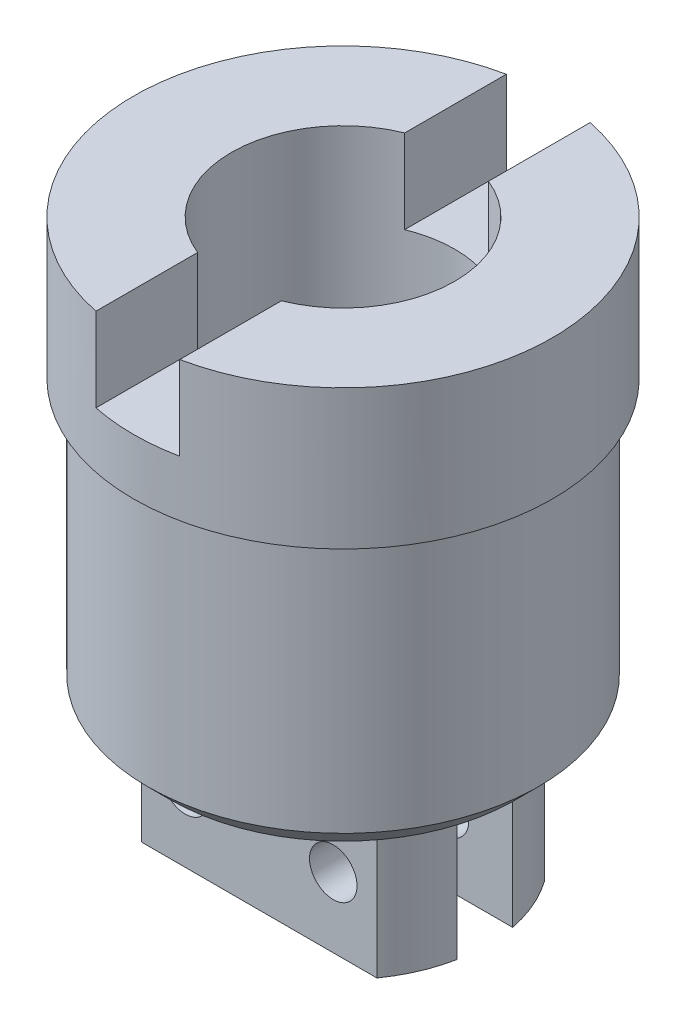
from build123d import *

# Parameters (mm, degrees)
CROQUIS1_R                               = 7.5
CROQUIS1_R_2                             = 4
SALIENTE_EXTRUIR1_DEPTH                  = 15
CROQUIS2_W                               = 3
CROQUIS2_H                               = 16.302446726
CORTAR_EXTRUIR1_DEPTH                    = 3
SALIENTE_EXTRUIR2_START                  = 5
SALIENTE_EXTRUIR2_DEPTH                  = 5
TALADRO_DE_MARGEN_PARA_M1_61_D           = 1.7
TALADRO_DE_MARGEN_PARA_M1_61_CSINK_D     = 1.75
TALADRO_DE_MARGEN_PARA_M1_61_CSINK_ANGLE = 82
REDONDEO1_R                              = 2
SALIENTE_EXTRUIR3_DEPTH                  = 5


# Read off the part's stored shape, not the designer's step: M14x1.5 Roscas Standard Taladro1
with BuildPart() as part:
    # Croquis1 → Saliente-Extruir1 (new body)
    with BuildSketch(Plane(origin=(0, 0, 0), x_dir=(1, 0, 0), z_dir=(0, 1, 0))):
        with Locations(Location((0, 0, 0), (0, 0, 270))):
            Circle(CROQUIS1_R)
        with Locations(Location((0, 0, 0), (0, 0, 270))):
            Circle(CROQUIS1_R_2, mode=Mode.SUBTRACT)
    extrude(amount=SALIENTE_EXTRUIR1_DEPTH)

    # Croquis2 → Cortar-Extruir1 (cut)
    with BuildSketch(Plane(origin=(0, 15, 0), x_dir=(1, 0, 0), z_dir=(0, 1, 0))):
        Rectangle(CROQUIS2_W, CROQUIS2_H)
    extrude(amount=-CORTAR_EXTRUIR1_DEPTH, mode=Mode.SUBTRACT)

    # M14x1.5 Roscas Standard Taladro1 outline → M14x1.5 Roscas Standard Taladro1 (revolve, cut)
    with BuildSketch(Plane.XY):
        Polygon((6.172, 0), (7.5, 0), (7.5, 10), (7, 10), (7, 0.828), align=None)
    revolve(axis=Axis((0, 0, 0), (0, 1, 0)), mode=Mode.SUBTRACT)

    # Croquis4 → Saliente-Extruir2 (add)
    with BuildSketch(Plane.XZ.offset(SALIENTE_EXTRUIR2_START)):
        with BuildLine():
            ThreePointArc((2.645751311, -3), (3.409321836, -2.092014488), (3.872983346, -1))
            Line((3.872983346, -1), (-3.872983346, -1))
            ThreePointArc((-3.872983346, -1), (-3.409321836, -2.092014488), (-2.645751311, -3))
            Line((-2.645751311, -3), (2.645751311, -3))
        make_face()
        with BuildLine():
            Line((-3.872983346, 1), (3.872983346, 1))
            ThreePointArc((3.872983346, 1), (3.409321836, 2.092014488), (2.645751311, 3))
            Line((2.645751311, 3), (-2.645751311, 3))
            ThreePointArc((-2.645751311, 3), (-3.409321836, 2.092014488), (-3.872983346, 1))
        make_face()
        with BuildLine():
            Line((3.872983346, 1), (5.074404793, 1))
            ThreePointArc((5.074404793, 1), (4.750167411, 2.045847884), (4.213025516, 3))
            Line((4.213025516, 3), (2.645751311, 3))
            ThreePointArc((2.645751311, 3), (3.409321836, 2.092014488), (3.872983346, 1))
        make_face()
        with BuildLine():
            Line((-5.074404793, 1), (-3.872983346, 1))
            ThreePointArc((-3.872983346, 1), (-3.409321836, 2.092014488), (-2.645751311, 3))
            Line((-2.645751311, 3), (-4.213025516, 3))
            ThreePointArc((-4.213025516, 3), (-4.750167411, 2.045847884), (-5.074404793, 1))
        make_face()
        with BuildLine():
            ThreePointArc((4.213025516, -3), (4.750167411, -2.045847884), (5.074404793, -1))
            Line((5.074404793, -1), (3.872983346, -1))
            ThreePointArc((3.872983346, -1), (3.409321836, -2.092014488), (2.645751311, -3))
            Line((2.645751311, -3), (4.213025516, -3))
        make_face()
        with BuildLine():
            ThreePointArc((-2.645751311, -3), (-3.409321836, -2.092014488), (-3.872983346, -1))
            Line((-3.872983346, -1), (-5.074404793, -1))
            ThreePointArc((-5.074404793, -1), (-4.750167411, -2.045847884), (-4.213025516, -3))
            Line((-4.213025516, -3), (-2.645751311, -3))
        make_face()
    extrude(amount=-SALIENTE_EXTRUIR2_DEPTH)

    # Taladro de margen para M1.61 (through all)
    with Locations(Plane(origin=(0, 0, -3), x_dir=(1, 0, 0), z_dir=(0, 0, -1))):
        with Locations((2.65, 2.5), (-2.65, 2.5)):
            CounterSinkHole(TALADRO_DE_MARGEN_PARA_M1_61_D / 2, TALADRO_DE_MARGEN_PARA_M1_61_CSINK_D / 2, counter_sink_angle=TALADRO_DE_MARGEN_PARA_M1_61_CSINK_ANGLE)

    # Redondeo1
    # the kernel refuses this fillet: 2 mm, written as the material it adds along each edge
    with BuildSketch(Plane(origin=(0, 0, 0), x_dir=(0.503234651569935, 0, -0.8641498049871251), z_dir=(0.8641498049871251, 0, 0.503234651569935))) as redondeo1_piece_1_section:
        with BuildLine():
            CenterArc((4 - REDONDEO1_R, REDONDEO1_R), REDONDEO1_R, 270, 90)
            Line((4 - REDONDEO1_R, 0), (4, 0))
            Line((4, 0), (4, REDONDEO1_R))
        make_face()
    redondeo1_piece_1 = revolve(axis=Axis((0, 0, 0), (0, 1, 0)), revolution_arc=177.360579055, mode=Mode.PRIVATE)
    redondeo1_piece_1 = split(redondeo1_piece_1, bisect_by=Plane(origin=(0.549602468, 0.055077536, -1), z_dir=(0, 0, -1)), keep=Keep.TOP, mode=Mode.PRIVATE)
    redondeo1_piece_1 = split(redondeo1_piece_1, bisect_by=Plane(origin=(0.549602468, 0.055077536, -3), z_dir=(0, 0, 1)), keep=Keep.TOP, mode=Mode.PRIVATE)
    add(redondeo1_piece_1)
    with BuildSketch(Plane(origin=(0, 0, 0), x_dir=(0.503234651569935, 0, -0.8641498049871251), z_dir=(0.8641498049871251, 0, 0.503234651569935))) as redondeo1_piece_2_section:
        with BuildLine():
            CenterArc((4 - REDONDEO1_R, REDONDEO1_R), REDONDEO1_R, 270, 90)
            Line((4 - REDONDEO1_R, 0), (4, 0))
            Line((4, 0), (4, REDONDEO1_R))
        make_face()
    redondeo1_piece_2 = revolve(axis=Axis((0, 0, 0), (0, 1, 0)), revolution_arc=177.360579055, mode=Mode.PRIVATE)
    redondeo1_piece_2 = split(redondeo1_piece_2, bisect_by=Plane(origin=(-2.883008057, 0.461894683, 3), z_dir=(0, 0, -1)), keep=Keep.TOP, mode=Mode.PRIVATE)
    redondeo1_piece_2 = split(redondeo1_piece_2, bisect_by=Plane(origin=(-2.883008057, 0.461894683, 1), z_dir=(0, 0, 1)), keep=Keep.TOP, mode=Mode.PRIVATE)
    add(redondeo1_piece_2)
    with BuildSketch(Plane(origin=(0, 0, 0), x_dir=(0.5424951341174628, 0, 0.8400589440383789), z_dir=(-0.8400589440383789, 0, 0.5424951341174628))) as redondeo1_piece_3_section:
        with BuildLine():
            CenterArc((4 - REDONDEO1_R, REDONDEO1_R), REDONDEO1_R, 270, 90)
            Line((4 - REDONDEO1_R, 0), (4, 0))
            Line((4, 0), (4, REDONDEO1_R))
        make_face()
    redondeo1_piece_3 = revolve(axis=Axis((0, 0, 0), (0, 1, 0)), revolution_arc=177.360579055, mode=Mode.PRIVATE)
    redondeo1_piece_3 = split(redondeo1_piece_3, bisect_by=Plane(origin=(2.883008085, 0.461894764, 3), z_dir=(0, 0, -1)), keep=Keep.TOP, mode=Mode.PRIVATE)
    redondeo1_piece_3 = split(redondeo1_piece_3, bisect_by=Plane(origin=(2.883008085, 0.461894764, 1), z_dir=(0, 0, 1)), keep=Keep.TOP, mode=Mode.PRIVATE)
    add(redondeo1_piece_3)
    with BuildSketch(Plane(origin=(0, 0, 0), x_dir=(0.5424951341174628, 0, 0.8400589440383789), z_dir=(-0.8400589440383789, 0, 0.5424951341174628))) as redondeo1_piece_4_section:
        with BuildLine():
            CenterArc((4 - REDONDEO1_R, REDONDEO1_R), REDONDEO1_R, 270, 90)
            Line((4 - REDONDEO1_R, 0), (4, 0))
            Line((4, 0), (4, REDONDEO1_R))
        make_face()
    redondeo1_piece_4 = revolve(axis=Axis((0, 0, 0), (0, 1, 0)), revolution_arc=177.360579055, mode=Mode.PRIVATE)
    redondeo1_piece_4 = split(redondeo1_piece_4, bisect_by=Plane(origin=(3.341819362, 1.478859592, -1), z_dir=(0, 0, -1)), keep=Keep.TOP, mode=Mode.PRIVATE)
    redondeo1_piece_4 = split(redondeo1_piece_4, bisect_by=Plane(origin=(3.341819362, 1.478859592, -3), z_dir=(0, 0, 1)), keep=Keep.TOP, mode=Mode.PRIVATE)
    add(redondeo1_piece_4)
    with BuildSketch(Plane(origin=(0, 0, 0), x_dir=(-0.5032346515699374, 0, 0.8641498049871236), z_dir=(-0.8641498049871236, 0, -0.5032346515699374))) as redondeo1_piece_5_section:
        with BuildLine():
            CenterArc((4 - REDONDEO1_R, REDONDEO1_R), REDONDEO1_R, 270, 90)
            Line((4 - REDONDEO1_R, 0), (4, 0))
            Line((4, 0), (4, REDONDEO1_R))
        make_face()
    redondeo1_piece_5 = revolve(axis=Axis((0, 0, 0), (0, 1, 0)), revolution_arc=177.360579055, mode=Mode.PRIVATE)
    redondeo1_piece_5 = split(redondeo1_piece_5, bisect_by=Plane(origin=(-0.549602468, 0.055077536, 3), z_dir=(0, 0, -1)), keep=Keep.TOP, mode=Mode.PRIVATE)
    redondeo1_piece_5 = split(redondeo1_piece_5, bisect_by=Plane(origin=(-0.549602468, 0.055077536, 1), z_dir=(0, 0, 1)), keep=Keep.TOP, mode=Mode.PRIVATE)
    add(redondeo1_piece_5)
    with BuildSketch(Plane(origin=(0, 0, 0), x_dir=(-0.5032346515699374, 0, 0.8641498049871236), z_dir=(-0.8641498049871236, 0, -0.5032346515699374))) as redondeo1_piece_6_section:
        with BuildLine():
            CenterArc((4 - REDONDEO1_R, REDONDEO1_R), REDONDEO1_R, 270, 90)
            Line((4 - REDONDEO1_R, 0), (4, 0))
            Line((4, 0), (4, REDONDEO1_R))
        make_face()
    redondeo1_piece_6 = revolve(axis=Axis((0, 0, 0), (0, 1, 0)), revolution_arc=177.360579055, mode=Mode.PRIVATE)
    redondeo1_piece_6 = split(redondeo1_piece_6, bisect_by=Plane(origin=(2.883008057, 0.461894683, -1), z_dir=(0, 0, -1)), keep=Keep.TOP, mode=Mode.PRIVATE)
    redondeo1_piece_6 = split(redondeo1_piece_6, bisect_by=Plane(origin=(2.883008057, 0.461894683, -3), z_dir=(0, 0, 1)), keep=Keep.TOP, mode=Mode.PRIVATE)
    add(redondeo1_piece_6)
    with BuildSketch(Plane(origin=(0, 0, 0), x_dir=(-0.542495134117437, 0, -0.8400589440383955), z_dir=(0.8400589440383955, 0, -0.542495134117437))) as redondeo1_piece_7_section:
        with BuildLine():
            CenterArc((4 - REDONDEO1_R, REDONDEO1_R), REDONDEO1_R, 270, 90)
            Line((4 - REDONDEO1_R, 0), (4, 0))
            Line((4, 0), (4, REDONDEO1_R))
        make_face()
    redondeo1_piece_7 = revolve(axis=Axis((0, 0, 0), (0, 1, 0)), revolution_arc=177.360579055, mode=Mode.PRIVATE)
    redondeo1_piece_7 = split(redondeo1_piece_7, bisect_by=Plane(origin=(-2.883008085, 0.461894764, -1), z_dir=(0, 0, -1)), keep=Keep.TOP, mode=Mode.PRIVATE)
    redondeo1_piece_7 = split(redondeo1_piece_7, bisect_by=Plane(origin=(-2.883008085, 0.461894764, -3), z_dir=(0, 0, 1)), keep=Keep.TOP, mode=Mode.PRIVATE)
    add(redondeo1_piece_7)
    with BuildSketch(Plane(origin=(0, 0, 0), x_dir=(-0.542495134117437, 0, -0.8400589440383955), z_dir=(0.8400589440383955, 0, -0.542495134117437))) as redondeo1_piece_8_section:
        with BuildLine():
            CenterArc((4 - REDONDEO1_R, REDONDEO1_R), REDONDEO1_R, 270, 90)
            Line((4 - REDONDEO1_R, 0), (4, 0))
            Line((4, 0), (4, REDONDEO1_R))
        make_face()
    redondeo1_piece_8 = revolve(axis=Axis((0, 0, 0), (0, 1, 0)), revolution_arc=177.360579055, mode=Mode.PRIVATE)
    redondeo1_piece_8 = split(redondeo1_piece_8, bisect_by=Plane(origin=(-3.341819362, 1.478859592, 3), z_dir=(0, 0, -1)), keep=Keep.TOP, mode=Mode.PRIVATE)
    redondeo1_piece_8 = split(redondeo1_piece_8, bisect_by=Plane(origin=(-3.341819362, 1.478859592, 1), z_dir=(0, 0, 1)), keep=Keep.TOP, mode=Mode.PRIVATE)
    add(redondeo1_piece_8)

    # Croquis10 → Saliente-Extruir3 (add)
    with BuildSketch(Plane.XZ):
        with BuildLine():
            ThreePointArc((2.645751311, 3), (0, 4), (-2.645751311, 3))
            Line((-2.645751311, 3), (2.645751311, 3))
        make_face()
        with BuildLine():
            ThreePointArc((-2.645751311, -3), (0, -4), (2.645751311, -3))
            Line((2.645751311, -3), (-2.645751311, -3))
        make_face()
    extrude(amount=-SALIENTE_EXTRUIR3_DEPTH)


solid = part.part
